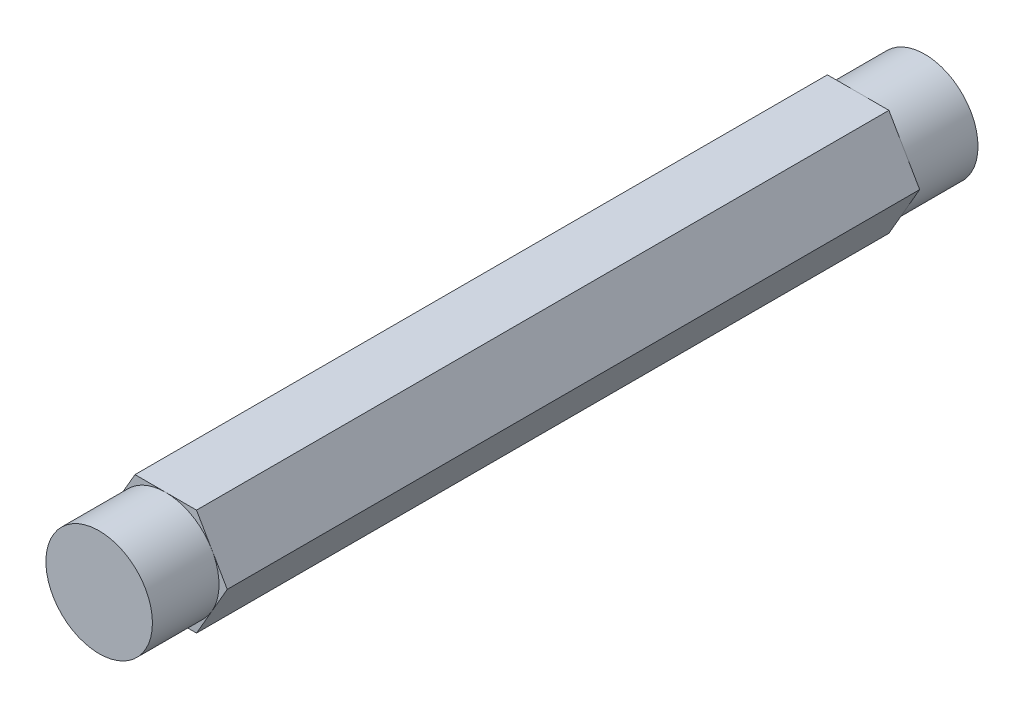
from build123d import *

# Parameters (mm, degrees)
BOSS_EXTRUDE1_DEPTH = 49.2125
SKETCH2_OUTSIDE_W   = 36.728
SKETCH2_OUTSIDE_H   = 34.764
SKETCH2_OUTSIDE_R   = 6.35
CUT_EXTRUDE1_DEPTH  = 7.9375


with BuildPart() as part:
    # Sketch1 → Boss-Extrude1 (new, symmetric)
    with BuildSketch(Plane.XY):
        Polygon((3.666174209, 6.35), (-3.666174209, 6.35), (-7.332348419, 0), (-3.666174209, -6.35), (3.666174209, -6.35), (7.332348419, 0), align=None)
    extrude(amount=BOSS_EXTRUDE1_DEPTH, both=True)

    # Sketch2 outside → Cut-Extrude1 (cut)
    with BuildSketch(Plane.XY.offset(49.2125)):
        Rectangle(SKETCH2_OUTSIDE_W, SKETCH2_OUTSIDE_H)
        Circle(SKETCH2_OUTSIDE_R, mode=Mode.SUBTRACT)
    cut_extrude1 = extrude(amount=-CUT_EXTRUDE1_DEPTH, mode=Mode.SUBTRACT)

    # Mirror1: Cut-Extrude1 across plane
    add(cut_extrude1.mirror(Plane.XY), mode=Mode.SUBTRACT)


solid = part.part
